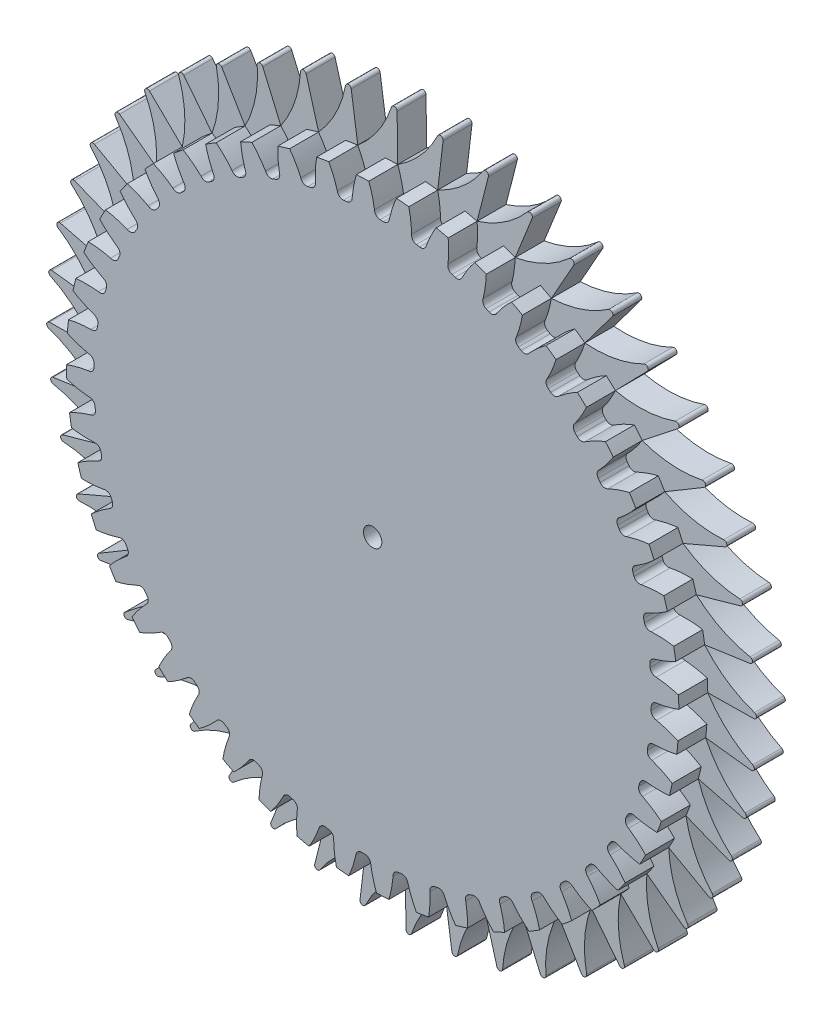
from build123d import *

# Parameters (mm, degrees)
SKETCH1_R                = 52.959
BOSS_EXTRUDE1_DEPTH      = 5
CUT_EXTRUDE1_DEPTH       = 76.062050079
FILLET1_R                = 0.997458
CIRPATTERN1_COUNT        = 48
FILLET1_OF_CIRPATTERN1_R = 0.997458
SKETCH5_R                = 1.5875
CUT_EXTRUDE2_DEPTH       = 76.056157207
BOSS_EXTRUDE2_DEPTH      = 5


with BuildPart() as part:
    # Sketch1 → Boss-Extrude1 (new body)
    with BuildSketch(Plane.XY):
        Circle(SKETCH1_R)
    extrude(amount=-BOSS_EXTRUDE1_DEPTH)

    # Sketch4 → Cut-Extrude1 (cut, through all)
    with BuildSketch(Plane.XY):
        with BuildLine():
            Line((0.320218521, 49.180857664), (0.320218521, 48.195436219))
            ThreePointArc((0.320218521, 48.195436219), (1.576948961, 48.17069487), (2.832606799, 48.11318895))
            Line((2.832606799, 48.11318895), (2.897056595, 49.096500523))
            add(Edge.make_bspline(
                [(8.900110231, 59.306700322), (4.18446068, 54.917639807), (2.897056595, 49.096500523)],
                knots=[0, 0, 0, 1, 1, 1], degree=2))
            ThreePointArc((8.900110231, 59.306700322), (1.962194108, 59.93868917), (-5.00220148, 59.761815949))
            add(Edge.make_bspline(
                [(-5.00220148, 59.761815949), (-0.583707506, 55.073733836), (0.320218521, 49.180857664)],
                knots=[0, 0, 0, 1, 1, 1], degree=2))
        make_face()
    cut_extrude1 = extrude(amount=-CUT_EXTRUDE1_DEPTH, mode=Mode.SUBTRACT)

    # Fillet1
    fillet1_edges = [part.edges().sort_by_distance(p)[0] for p in [
        (2.832606799, 48.11318895, -2.5),
        (0.320218521, 48.195436219, -2.5),
    ]]
    fillet(fillet1_edges, radius=FILLET1_R)

    # CirPattern1: Cut-Extrude1 ×48 about axis
    cirpattern1_axis = Axis((0, 0, -5), (0, 0, 1))
    for i in range(1, CIRPATTERN1_COUNT):
        add(cut_extrude1.rotate(cirpattern1_axis, i * 360 / CIRPATTERN1_COUNT), mode=Mode.SUBTRACT)

    # Fillet1 of CirPattern1
    fillet1_of_cirpattern1_edges = [part.edges().sort_by_distance(p)[0] for p in [
        (-3.471657894, 48.071303329, -2.5),
        (-5.973287765, 47.824914485, -2.5),
        (-9.716521558, 47.206904379, -2.5),
        (-12.164589441, 46.636095205, -2.5),
        (-15.795132844, 45.534782207, -2.5),
        (-18.147751619, 44.649319406, -2.5),
        (-21.603485028, 43.083547288, -2.5),
        (-23.820400736, 41.898581373, -2.5),
        (-27.042195594, 39.895140929, -2.5),
        (-29.085476191, 38.430946995, -2.5),
        (-32.018206695, 36.024117647, -2.5),
        (-33.852891085, 34.30574846, -2.5),
        (-36.446377403, 31.536711725, -2.5),
        (-38.041073627, 29.593569057, -2.5),
        (-40.250940489, 26.509703922, -2.5),
        (-41.578362852, 24.375035483, -2.5),
        (-43.366798823, 21.029107735, -2.5),
        (-44.404234761, 18.739438294, -2.5),
        (-45.740639205, 15.188697684, -2.5),
        (-46.470337902, 12.78320412, -2.5),
        (-47.33184457, 9.088404804, -2.5),
        (-47.741320677, 6.608245779, -2.5),
        (-48.11318895, 2.832606799, -2.5),
        (-48.195436219, 0.320218521, -2.5),
        (-48.071303329, -3.471657894, -2.5),
        (-47.824914485, -5.973287765, -2.5),
        (-47.206904379, -9.716521558, -2.5),
        (-46.636095205, -12.164589441, -2.5),
        (-45.534782207, -15.795132844, -2.5),
        (-44.649319406, -18.147751619, -2.5),
        (-43.083547288, -21.603485028, -2.5),
        (-41.898581373, -23.820400736, -2.5),
        (-39.895140929, -27.042195594, -2.5),
        (-38.430946995, -29.085476191, -2.5),
        (-36.024117647, -32.018206695, -2.5),
        (-34.30574846, -33.852891085, -2.5),
        (-31.536711725, -36.446377403, -2.5),
        (-29.593569057, -38.041073627, -2.5),
        (-26.509703922, -40.250940489, -2.5),
        (-24.375035483, -41.578362852, -2.5),
        (-21.029107735, -43.366798823, -2.5),
        (-18.739438294, -44.404234761, -2.5),
        (-15.188697684, -45.740639205, -2.5),
        (-12.78320412, -46.470337902, -2.5),
        (-9.088404804, -47.33184457, -2.5),
        (-6.608245779, -47.741320677, -2.5),
        (-2.832606799, -48.11318895, -2.5),
        (-0.320218521, -48.195436219, -2.5),
        (3.471657894, -48.071303329, -2.5),
        (5.973287765, -47.824914485, -2.5),
        (9.716521558, -47.206904379, -2.5),
        (12.164589441, -46.636095205, -2.5),
        (15.795132844, -45.534782207, -2.5),
        (18.147751619, -44.649319406, -2.5),
        (21.603485028, -43.083547288, -2.5),
        (23.820400736, -41.898581373, -2.5),
        (27.042195594, -39.895140929, -2.5),
        (29.085476191, -38.430946995, -2.5),
        (32.018206695, -36.024117647, -2.5),
        (33.852891085, -34.30574846, -2.5),
        (36.446377403, -31.536711725, -2.5),
        (38.041073627, -29.593569057, -2.5),
        (40.250940489, -26.509703922, -2.5),
        (41.578362852, -24.375035483, -2.5),
        (43.366798823, -21.029107735, -2.5),
        (44.404234761, -18.739438294, -2.5),
        (45.740639205, -15.188697684, -2.5),
        (46.470337902, -12.78320412, -2.5),
        (47.33184457, -9.088404804, -2.5),
        (47.741320677, -6.608245779, -2.5),
        (48.11318895, -2.832606799, -2.5),
        (48.195436219, -0.320218521, -2.5),
        (48.071303329, 3.471657894, -2.5),
        (47.824914485, 5.973287765, -2.5),
        (47.206904379, 9.716521558, -2.5),
        (46.636095205, 12.164589441, -2.5),
        (45.534782207, 15.795132844, -2.5),
        (44.649319406, 18.147751619, -2.5),
        (43.083547288, 21.603485028, -2.5),
        (41.898581373, 23.820400736, -2.5),
        (39.895140929, 27.042195594, -2.5),
        (38.430946995, 29.085476191, -2.5),
        (36.024117647, 32.018206695, -2.5),
        (34.30574846, 33.852891085, -2.5),
        (31.536711725, 36.446377403, -2.5),
        (29.593569057, 38.041073627, -2.5),
        (26.509703922, 40.250940489, -2.5),
        (24.375035483, 41.578362852, -2.5),
        (21.029107735, 43.366798823, -2.5),
        (18.739438294, 44.404234761, -2.5),
        (15.188697684, 45.740639205, -2.5),
        (12.78320412, 46.470337902, -2.5),
        (9.088404804, 47.33184457, -2.5),
        (6.608245779, 47.741320677, -2.5),
    ]]
    fillet(fillet1_of_cirpattern1_edges, radius=FILLET1_OF_CIRPATTERN1_R)

    # Sketch5 → Cut-Extrude2 (cut, through all)
    with BuildSketch(Plane.XY):
        Circle(SKETCH5_R)
    extrude(amount=-CUT_EXTRUDE2_DEPTH, mode=Mode.SUBTRACT)

    # Sketch6 → Boss-Extrude2 (add)
    with BuildSketch(Plane.XY.offset(-5)):
        with BuildLine():
            ThreePointArc((6.240596378, 60.726623071), (3.328200071, 56.360512114), (-0.665077228, 52.954823702))
            Line((-0.665077228, 52.954823702), (-0.764499712, 60.871047409))
            ThreePointArc((-0.764499712, 60.871047409), (-1.188106239, 61.358903908), (-1.739207665, 61.021659674))
            ThreePointArc((-1.739207665, 61.021659674), (-4.05679618, 56.312757402), (-7.571378897, 52.414977846))
            Line((-7.571378897, 52.414977846), (-8.703225345, 60.250499924))
            ThreePointArc((-8.703225345, 60.250499924), (-9.186885912, 60.678890995), (-9.689253382, 60.272598763))
            ThreePointArc((-9.689253382, 60.272598763), (-11.372379523, 55.301475798), (-14.348132175, 50.978297187))
            Line((-14.348132175, 50.978297187), (-16.49303638, 58.59904968))
            ThreePointArc((-16.49303638, 58.59904968), (-17.028475419, 58.960645435), (-17.473513288, 58.492256976))
            ThreePointArc((-17.473513288, 58.492256976), (-18.4933783, 53.34397061), (-20.879384933, 48.66936373))
            Line((-20.879384933, 48.66936373), (-24.00064699, 55.94495345))
            ThreePointArc((-24.00064699, 55.94495345), (-24.578702991, 56.233566884), (-24.958796537, 55.711096454))
            ThreePointArc((-24.958796537, 55.711096454), (-25.297950247, 50.473735296), (-27.053385625, 45.527683965))
            Line((-27.053385625, 45.527683965), (-31.097599876, 52.333623555))
            ThreePointArc((-31.097599876, 52.333623555), (-31.70838214, 52.544316413), (-32.017027857, 51.976703627))
            ThreePointArc((-32.017027857, 51.976703627), (-31.669667251, 46.739880377), (-32.76449539, 41.607012905))
            Line((-32.76449539, 41.607012905), (-37.662464206, 47.826850852))
            ThreePointArc((-37.662464206, 47.826850852), (-38.295522079, 47.95601812), (-38.527438954, 47.35297499))
            ThreePointArc((-38.527438954, 47.35297499), (-37.499507468, 42.206293146), (-37.914995554, 36.974434318))
            Line((-37.914995554, 36.974434318), (-43.582913331, 42.50174747))
            ThreePointArc((-43.582913331, 42.50174747), (-44.227415018, 42.547179061), (-44.378634889, 41.919023822))
            ThreePointArc((-44.378634889, 41.919023822), (-42.687720715, 36.950544537), (-42.416759632, 31.70921291))
            Line((-42.416759632, 31.70921291), (-48.757646726, 36.449427406))
            ThreePointArc((-48.757646726, 36.449427406), (-49.402564624, 36.410345972), (-49.470500076, 35.767826534))
            ThreePointArc((-49.470500076, 35.767826534), (-47.145535226, 31.062561867), (-46.192761192, 25.901438076))
            Line((-46.192761192, 25.901438076), (-53.098123267, 29.773447533))
            ThreePointArc((-53.098123267, 29.773447533), (-53.732422652, 29.650521768), (-53.715911291, 29.004631817))
            ThreePointArc((-53.715911291, 29.004631817), (-50.796676557, 24.643090151), (-49.178391802, 19.650482456))
            Line((-49.178391802, 19.650482456), (-56.530076197, 22.588035718))
            ThreePointArc((-56.530076197, 22.588035718), (-57.142904031, 22.383368917), (-57.042228372, 21.745159809))
            ThreePointArc((-57.042228372, 21.745159809), (-53.578672669, 17.80196833), (-51.322566493, 13.063301634))
            Line((-51.322566493, 13.063301634), (-58.994783851, 15.016136349))
            ThreePointArc((-58.994783851, 15.016136349), (-59.57565448, 14.733230417), (-59.39253711, 14.113622087))
            ThreePointArc((-59.39253711, 14.113622087), (-55.443922837, 10.656249896), (-52.588597842, 6.252604098))
            Line((-52.588597842, 6.252604098), (-60.450074396, 7.187306724))
            ThreePointArc((-60.450074396, 7.187306724), (-60.989048962, 6.83100226), (-60.726623071, 6.240596378))
            ThreePointArc((-60.726623071, 6.240596378), (-56.360512114, 3.328200071), (-52.954823702, -0.665077227))
            Line((-52.954823702, -0.665077227), (-60.871047409, -0.764499712))
            ThreePointArc((-60.871047409, -0.764499712), (-61.358903908, -1.188106239), (-61.021659674, -1.739207664))
            ThreePointArc((-61.021659674, -1.739207664), (-56.312757402, -4.05679618), (-52.414977846, -7.571378897))
            Line((-52.414977846, -7.571378897), (-60.250499924, -8.703225345))
            ThreePointArc((-60.250499924, -8.703225345), (-60.678890995, -9.186885912), (-60.272598763, -9.689253382))
            ThreePointArc((-60.272598763, -9.689253382), (-55.301475798, -11.372379523), (-50.978297187, -14.348132175))
            Line((-50.978297187, -14.348132175), (-58.59904968, -16.49303638))
            ThreePointArc((-58.59904968, -16.49303638), (-58.960645435, -17.028475419), (-58.492256976, -17.473513288))
            ThreePointArc((-58.492256976, -17.473513288), (-53.34397061, -18.4933783), (-48.66936373, -20.879384932))
            Line((-48.66936373, -20.879384932), (-55.94495345, -24.00064699))
            ThreePointArc((-55.94495345, -24.00064699), (-56.233566884, -24.57870299), (-55.711096454, -24.958796537))
            ThreePointArc((-55.711096454, -24.958796537), (-50.473735296, -25.297950247), (-45.527683965, -27.053385625))
            Line((-45.527683965, -27.053385625), (-52.333623555, -31.097599876))
            ThreePointArc((-52.333623555, -31.097599876), (-52.544316413, -31.708382139), (-51.976703627, -32.017027857))
            ThreePointArc((-51.976703627, -32.017027857), (-46.739880377, -31.669667251), (-41.607012905, -32.76449539))
            Line((-41.607012905, -32.76449539), (-47.826850852, -37.662464206))
            ThreePointArc((-47.826850852, -37.662464206), (-47.95601812, -38.295522079), (-47.35297499, -38.527438954))
            ThreePointArc((-47.35297499, -38.527438954), (-42.206293146, -37.499507468), (-36.974434318, -37.914995554))
            Line((-36.974434318, -37.914995554), (-42.50174747, -43.582913331))
            ThreePointArc((-42.50174747, -43.582913331), (-42.547179061, -44.227415018), (-41.919023822, -44.378634888))
            ThreePointArc((-41.919023822, -44.378634888), (-36.950544537, -42.687720715), (-31.70921291, -42.416759632))
            Line((-31.70921291, -42.416759632), (-36.449427406, -48.757646726))
            ThreePointArc((-36.449427406, -48.757646726), (-36.410345972, -49.402564624), (-35.767826534, -49.470500076))
            ThreePointArc((-35.767826534, -49.470500076), (-31.062561867, -47.145535225), (-25.901438076, -46.192761192))
            Line((-25.901438076, -46.192761192), (-29.773447533, -53.098123267))
            ThreePointArc((-29.773447533, -53.098123267), (-29.650521768, -53.732422652), (-29.004631817, -53.715911291))
            ThreePointArc((-29.004631817, -53.715911291), (-24.643090151, -50.796676557), (-19.650482456, -49.178391802))
            Line((-19.650482456, -49.178391802), (-22.588035718, -56.530076197))
            ThreePointArc((-22.588035718, -56.530076197), (-22.383368917, -57.142904031), (-21.745159809, -57.042228372))
            ThreePointArc((-21.745159809, -57.042228372), (-17.80196833, -53.578672669), (-13.063301634, -51.322566493))
            Line((-13.063301634, -51.322566493), (-15.016136349, -58.994783851))
            ThreePointArc((-15.016136349, -58.994783851), (-14.733230417, -59.57565448), (-14.113622087, -59.392537109))
            ThreePointArc((-14.113622087, -59.392537109), (-10.656249896, -55.443922837), (-6.252604098, -52.588597842))
            Line((-6.252604098, -52.588597842), (-7.187306724, -60.450074396))
            ThreePointArc((-7.187306724, -60.450074396), (-6.83100226, -60.989048962), (-6.240596378, -60.726623071))
            ThreePointArc((-6.240596378, -60.726623071), (-3.328200071, -56.360512114), (0.665077228, -52.954823702))
            Line((0.665077228, -52.954823702), (0.764499712, -60.871047409))
            ThreePointArc((0.764499712, -60.871047409), (1.188106239, -61.358903908), (1.739207664, -61.021659674))
            ThreePointArc((1.739207664, -61.021659674), (4.05679618, -56.312757402), (7.571378897, -52.414977846))
            Line((7.571378897, -52.414977846), (8.703225345, -60.250499924))
            ThreePointArc((8.703225345, -60.250499924), (9.186885912, -60.678890995), (9.689253382, -60.272598763))
            ThreePointArc((9.689253382, -60.272598763), (11.372379523, -55.301475798), (14.348132175, -50.978297187))
            Line((14.348132175, -50.978297187), (16.49303638, -58.59904968))
            ThreePointArc((16.49303638, -58.59904968), (17.028475419, -58.960645435), (17.473513288, -58.492256976))
            ThreePointArc((17.473513288, -58.492256976), (18.4933783, -53.34397061), (20.879384932, -48.669363729))
            Line((20.879384932, -48.669363729), (24.00064699, -55.94495345))
            ThreePointArc((24.00064699, -55.94495345), (24.57870299, -56.233566884), (24.958796537, -55.711096454))
            ThreePointArc((24.958796537, -55.711096454), (25.297950247, -50.473735296), (27.053385625, -45.527683965))
            Line((27.053385625, -45.527683965), (31.097599876, -52.333623555))
            ThreePointArc((31.097599876, -52.333623555), (31.708382139, -52.544316413), (32.017027857, -51.976703627))
            ThreePointArc((32.017027857, -51.976703627), (31.669667251, -46.739880377), (32.76449539, -41.607012905))
            Line((32.76449539, -41.607012905), (37.662464206, -47.826850852))
            ThreePointArc((37.662464206, -47.826850852), (38.295522079, -47.95601812), (38.527438954, -47.35297499))
            ThreePointArc((38.527438954, -47.35297499), (37.499507468, -42.206293146), (37.914995554, -36.974434318))
            Line((37.914995554, -36.974434318), (43.582913331, -42.50174747))
            ThreePointArc((43.582913331, -42.50174747), (44.227415018, -42.547179061), (44.378634888, -41.919023822))
            ThreePointArc((44.378634888, -41.919023822), (42.687720715, -36.950544537), (42.416759632, -31.70921291))
            Line((42.416759632, -31.70921291), (48.757646726, -36.449427406))
            ThreePointArc((48.757646726, -36.449427406), (49.402564624, -36.410345972), (49.470500076, -35.767826534))
            ThreePointArc((49.470500076, -35.767826534), (47.145535225, -31.062561867), (46.192761192, -25.901438076))
            Line((46.192761192, -25.901438076), (53.098123267, -29.773447533))
            ThreePointArc((53.098123267, -29.773447533), (53.732422652, -29.650521768), (53.715911291, -29.004631817))
            ThreePointArc((53.715911291, -29.004631817), (50.796676557, -24.643090151), (49.178391802, -19.650482456))
            Line((49.178391802, -19.650482456), (56.530076197, -22.588035718))
            ThreePointArc((56.530076197, -22.588035718), (57.142904031, -22.383368917), (57.042228372, -21.745159809))
            ThreePointArc((57.042228372, -21.745159809), (53.578672669, -17.80196833), (51.322566493, -13.063301633))
            Line((51.322566493, -13.063301633), (58.994783851, -15.016136349))
            ThreePointArc((58.994783851, -15.016136349), (59.57565448, -14.733230417), (59.392537109, -14.113622087))
            ThreePointArc((59.392537109, -14.113622087), (55.443922837, -10.656249895), (52.588597842, -6.252604098))
            Line((52.588597842, -6.252604098), (60.450074396, -7.187306724))
            ThreePointArc((60.450074396, -7.187306724), (60.989048962, -6.83100226), (60.726623071, -6.240596378))
            ThreePointArc((60.726623071, -6.240596378), (56.360512114, -3.328200071), (52.954823702, 0.665077228))
            Line((52.954823702, 0.665077228), (60.871047409, 0.764499712))
            ThreePointArc((60.871047409, 0.764499712), (61.358903908, 1.188106239), (61.021659674, 1.739207665))
            ThreePointArc((61.021659674, 1.739207665), (56.312757402, 4.05679618), (52.414977846, 7.571378897))
            Line((52.414977846, 7.571378897), (60.250499924, 8.703225345))
            ThreePointArc((60.250499924, 8.703225345), (60.678890995, 9.186885912), (60.272598763, 9.689253382))
            ThreePointArc((60.272598763, 9.689253382), (55.301475798, 11.372379523), (50.978297187, 14.348132175))
            Line((50.978297187, 14.348132175), (58.59904968, 16.49303638))
            ThreePointArc((58.59904968, 16.49303638), (58.960645435, 17.028475419), (58.492256976, 17.473513288))
            ThreePointArc((58.492256976, 17.473513288), (53.34397061, 18.4933783), (48.669363729, 20.879384933))
            Line((48.669363729, 20.879384933), (55.94495345, 24.00064699))
            ThreePointArc((55.94495345, 24.00064699), (56.233566884, 24.578702991), (55.711096454, 24.958796537))
            ThreePointArc((55.711096454, 24.958796537), (50.473735296, 25.297950247), (45.527683965, 27.053385625))
            Line((45.527683965, 27.053385625), (52.333623555, 31.097599876))
            ThreePointArc((52.333623555, 31.097599876), (52.544316413, 31.70838214), (51.976703627, 32.017027857))
            ThreePointArc((51.976703627, 32.017027857), (46.739880377, 31.669667251), (41.607012905, 32.76449539))
            Line((41.607012905, 32.76449539), (47.826850852, 37.662464206))
            ThreePointArc((47.826850852, 37.662464206), (47.95601812, 38.295522079), (47.35297499, 38.527438954))
            ThreePointArc((47.35297499, 38.527438954), (42.206293146, 37.499507468), (36.974434318, 37.914995554))
            Line((36.974434318, 37.914995554), (42.50174747, 43.582913331))
            ThreePointArc((42.50174747, 43.582913331), (42.547179061, 44.227415018), (41.919023822, 44.378634889))
            ThreePointArc((41.919023822, 44.378634889), (36.950544537, 42.687720715), (31.70921291, 42.416759632))
            Line((31.70921291, 42.416759632), (36.449427406, 48.757646726))
            ThreePointArc((36.449427406, 48.757646726), (36.410345972, 49.402564624), (35.767826534, 49.470500076))
            ThreePointArc((35.767826534, 49.470500076), (31.062561867, 47.145535226), (25.901438076, 46.192761192))
            Line((25.901438076, 46.192761192), (29.773447533, 53.098123267))
            ThreePointArc((29.773447533, 53.098123267), (29.650521768, 53.732422652), (29.004631817, 53.715911291))
            ThreePointArc((29.004631817, 53.715911291), (24.643090151, 50.796676557), (19.650482456, 49.178391802))
            Line((19.650482456, 49.178391802), (22.588035718, 56.530076197))
            ThreePointArc((22.588035718, 56.530076197), (22.383368917, 57.142904031), (21.745159809, 57.042228372))
            ThreePointArc((21.745159809, 57.042228372), (17.80196833, 53.578672669), (13.063301633, 51.322566493))
            Line((13.063301633, 51.322566493), (15.016136349, 58.994783851))
            ThreePointArc((15.016136349, 58.994783851), (14.733230417, 59.57565448), (14.113622087, 59.39253711))
            ThreePointArc((14.113622087, 59.39253711), (10.656249895, 55.443922837), (6.252604098, 52.588597842))
            Line((6.252604098, 52.588597842), (7.187306724, 60.450074396))
            ThreePointArc((7.187306724, 60.450074396), (6.83100226, 60.989048962), (6.240596378, 60.726623071))
        make_face()
    extrude(amount=-BOSS_EXTRUDE2_DEPTH)


solid = part.part
